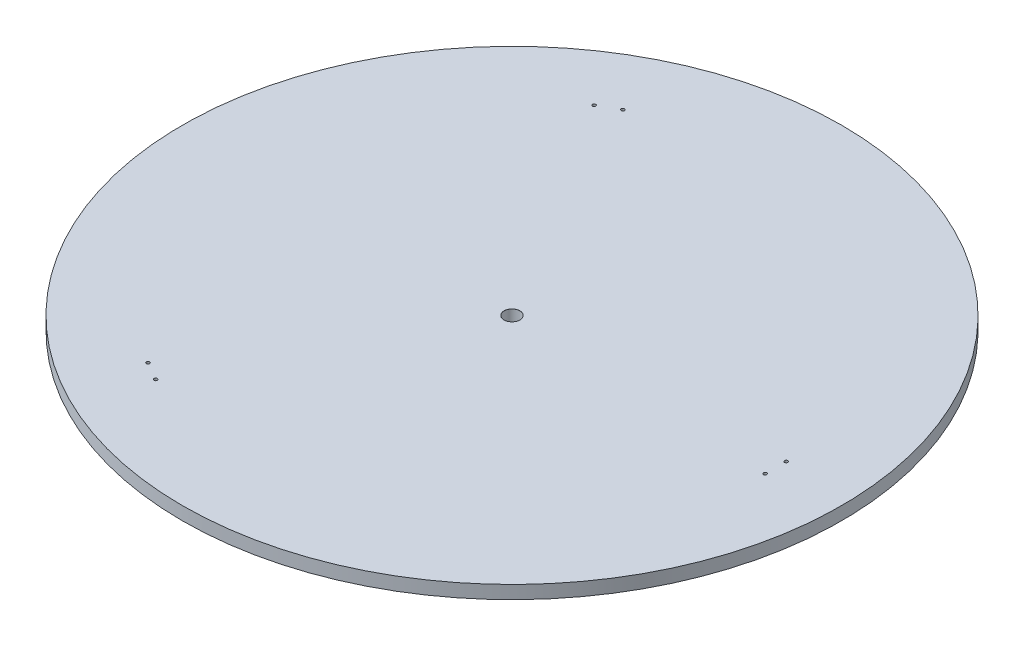
from build123d import *

# Parameters (mm, degrees)
ESQUISSE1_R                  = 250
BOSS_EXTRU_1_DEPTH           = 5
D_GAGEMENT_M101_D            = 12
D_GAGEMENT_M101_CSINK_D      = 12.05
D_GAGEMENT_M101_CSINK_ANGLE  = 90
ESQUISSE6_R                  = 1.25
ENL_V_MAT_EXTRU_1_DEPTH      = 354.694783677
R_P_TITION_CIRCULAIRE1_COUNT = 3


with BuildPart() as part:
    # Esquisse1 → Boss.-Extru.1 (new, symmetric)
    with BuildSketch(Plane(origin=(0, 0, 0), x_dir=(1, 0, 0), z_dir=(0, 1, 0))):
        Circle(ESQUISSE1_R)
    extrude(amount=BOSS_EXTRU_1_DEPTH, both=True)

    # Dégagement M101 (through all)
    with Locations(Plane(origin=(0, 5, 0), x_dir=(1, 0, 0), z_dir=(0, 1, 0))):
        with Locations((0, 0)):
            CounterSinkHole(D_GAGEMENT_M101_D / 2, D_GAGEMENT_M101_CSINK_D / 2, counter_sink_angle=D_GAGEMENT_M101_CSINK_ANGLE)

    # Esquisse6 → Enlèv. mat.-Extru.1 (cut, through all)
    with BuildSketch(Plane(origin=(0, 5, 0), x_dir=(1, 0, 0), z_dir=(0, 1, 0))):
        with Locations((200, 8)):
            Circle(ESQUISSE6_R)
        with Locations((200, -8)):
            Circle(ESQUISSE6_R)
    enl_v_mat_extru_1 = extrude(amount=-ENL_V_MAT_EXTRU_1_DEPTH, mode=Mode.SUBTRACT)

    # Répétition circulaire1: Enlèv. mat.-Extru.1 ×3 about axis
    r_p_tition_circulaire1_axis = Axis((0, 5, 0), (0, 1, 0))
    for i in range(1, R_P_TITION_CIRCULAIRE1_COUNT):
        add(enl_v_mat_extru_1.rotate(r_p_tition_circulaire1_axis, i * 360 / R_P_TITION_CIRCULAIRE1_COUNT), mode=Mode.SUBTRACT)


solid = part.part
